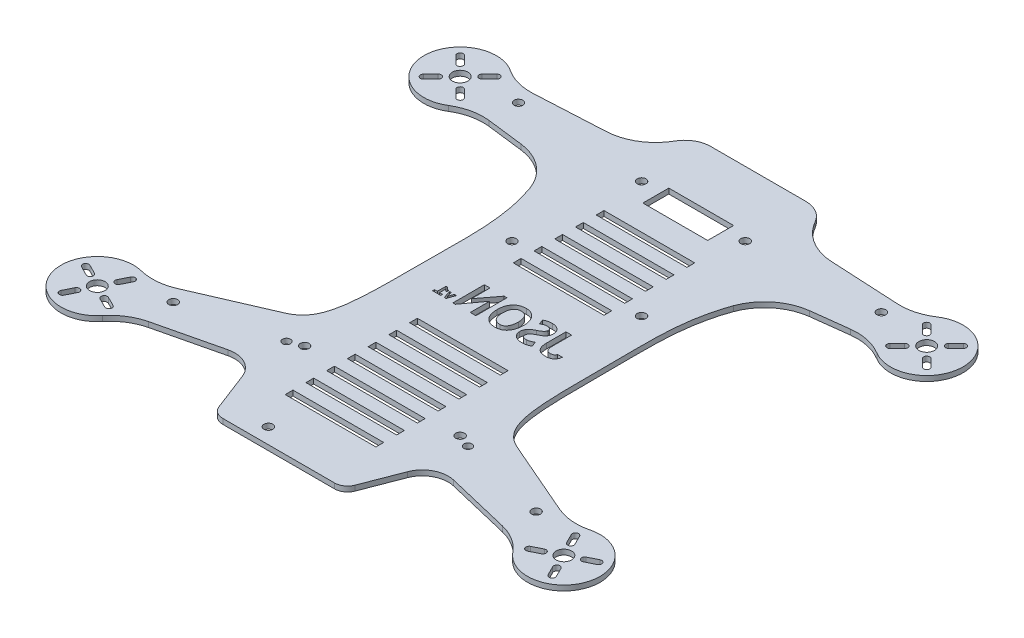
from build123d import *

# Parameters (mm, degrees)
BOSS_EXTRUDE1_DEPTH  = 2
FILLET1_DEPTH        = 2
FILLET2_R            = 10
FILLET3_R            = 20
FILLET4_R            = 10
CUT_EXTRUDE1_DEPTH   = 141.872282725
CUT_EXTRUDE3_DEPTH   = 141.872282725
SKETCH3_R            = 3
CUT_EXTRUDE2_DEPTH   = 141.872282725
CIRPATTERN1_COUNT    = 4
CIRPATTERN2_COUNT    = 4
MIRROR1_COPY_1_DEPTH = 141.872282725
MIRROR1_COPY_2_DEPTH = 141.872282725
MIRROR1_COPY_3_DEPTH = 141.872282725
MIRROR1_COPY_4_DEPTH = 141.872282725
MIRROR1_COPY_5_DEPTH = 141.872282725
MIRROR1_COPY_6_DEPTH = 141.872282725
SKETCH5_R            = 1.7
CUT_EXTRUDE4_DEPTH   = 141.872282725
SKETCH6_W            = 25
SKETCH6_H            = 10
CUT_EXTRUDE5_DEPTH   = 141.872282725
FILLET5_R            = 5
SKETCH7_W            = 35
SKETCH7_H            = 3
CUT_EXTRUDE6_DEPTH   = 141.872282725
SKETCH8_R            = 1.55
CUT_EXTRUDE7_DEPTH   = 141.872282725


with BuildPart() as part:
    # Sketch1 → Boss-Extrude1 (new body)
    with BuildSketch(Plane(origin=(0, 0, 0), x_dir=(1, 0, 0), z_dir=(0, 1, 0))):
        with BuildLine():
            Line((-78.510874707, 78), (-25, 80.804386111))
            Line((-25, 80.804386111), (-25, 95))
            Line((-25, 95), (25, 95))
            Line((25, 95), (25, 80.804386111))
            Line((25, 80.804386111), (78.510874707, 78))
            ThreePointArc((78.510874707, 78), (104, 70), (78.510874707, 62))
            Line((78.510874707, 62), (45, 57.885381964))
            add(Edge.make_bspline(
                [(45, 57.885381964), (33.861672059, 40.176941325), (35.131875882, 16.931364499), (34.80960819, -29.268629503), (36.343615545, -39.147258), (45, -42.89948064)],
                knots=[0, 0, 0, 0, 0.35075802, 0.45075802, 1, 1, 1, 1], degree=3))
            Line((45, -42.89948064), (81.630280853, -58.777353191))
            ThreePointArc((81.630280853, -58.777353191), (103.281566173, -74.427188724), (76.570636597, -73.956285959))
            Line((76.570636597, -73.956285959), (35, -64.025963414))
            Line((35, -64.025963414), (25, -90))
            Line((25, -90), (-25, -90))
            Line((-25, -90), (-35, -64.025963414))
            Line((-35, -64.025963414), (-76.570636597, -73.956285959))
            ThreePointArc((-76.570636597, -73.956285959), (-103.281566173, -74.427188724), (-81.630280853, -58.777353191))
            Line((-81.630280853, -58.777353191), (-45, -42.89948064))
            add(Edge.make_bspline(
                [(-45, 57.885381964), (-33.861672059, 40.176941325), (-35.131875882, 16.931364499), (-34.80960819, -29.268629503), (-36.343615545, -39.147258), (-45, -42.89948064)],
                knots=[0, 0, 0, 0, 0.35075802, 0.45075802, 1, 1, 1, 1], degree=3))
            Line((-45, 57.885381964), (-78.510874707, 62))
            ThreePointArc((-78.510874707, 62), (-104, 70), (-78.510874707, 78))
        make_face()
    extrude(amount=BOSS_EXTRUDE1_DEPTH)

    # Fillet1: read off the stored shape, not the designer's step
    # Fillet1 outline → Fillet1 (add)
    with BuildSketch(Plane(origin=(0, 0, 0), x_dir=(1, 0, 0), z_dir=(0, 1, 0))):
        with BuildLine():
            ThreePointArc((43.365148071, 79.841909484), (31.680788468, 84.389856442), (25, 95))
            Line((25, 95), (25, 80.804386111))
            Line((25, 80.804386111), (43.365148071, 79.841909484))
        make_face()
        with BuildLine():
            Line((-25, 80.804386111), (-25, 95))
            ThreePointArc((-25, 95), (-31.680788468, 84.389856442), (-43.365148071, 79.841909484))
            Line((-43.365148071, 79.841909484), (-25, 80.804386111))
        make_face()
    extrude(amount=FILLET1_DEPTH)

    # Fillet2
    fillet2_edges = [part.edges().sort_by_distance(p)[0] for p in [
        (-25, 1, -95),
        (25, 1, -95),
    ]]
    fillet(fillet2_edges, radius=FILLET2_R)

    # Fillet3
    fillet3_edges = [part.edges().sort_by_distance(p)[0] for p in [
        (76.570636597, 1, 73.956285959),
        (81.630280853, 1, 58.777353191),
        (-81.630280853, 1, 58.777353191),
        (-76.570636597, 1, 73.956285959),
        (78.510874707, 1, -78),
        (78.510874707, 1, -62),
        (45, 1, -57.885381964),
        (-45, 1, -57.885381964),
        (-78.510874707, 1, -78),
        (-78.510874707, 1, -62),
    ]]
    fillet(fillet3_edges, radius=FILLET3_R)

    # Fillet4
    fillet4_edges = [part.edges().sort_by_distance(p)[0] for p in [
        (35, 1, 64.025963414),
        (-35, 1, 64.025963414),
    ]]
    fillet(fillet4_edges, radius=FILLET4_R)

    # Sketch2 → Cut-Extrude1 (cut, through all)
    with BuildSketch(Plane(origin=(0, 2, 0), x_dir=(1, 0, 0), z_dir=(0, 1, 0))):
        with BuildLine():
            Line((-97.919595949, 63.777460326), (-95.091168825, 66.60588745))
            ThreePointArc((-95.091168825, 66.60588745), (-93.39411255, 66.60588745), (-93.39411255, 64.908831175))
            Line((-93.39411255, 64.908831175), (-96.222539674, 62.080404051))
            ThreePointArc((-96.222539674, 62.080404051), (-97.919595949, 62.080404051), (-97.919595949, 63.777460326))
        make_face()
    cut_extrude1 = extrude(amount=-CUT_EXTRUDE1_DEPTH, mode=Mode.SUBTRACT)

    # Sketch4 → Cut-Extrude3 (cut, through all)
    with BuildSketch(Plane(origin=(0, 2, 0), x_dir=(1, 0, 0), z_dir=(0, 1, 0))):
        with BuildLine():
            Line((-91.609968944, -75.903219461), (-93.398823326, -79.480928225))
            ThreePointArc((-93.398823326, -79.480928225), (-95.00879227, -80.017584539), (-95.545448584, -78.407615595))
            Line((-95.545448584, -78.407615595), (-93.756594202, -74.829906831))
            ThreePointArc((-93.756594202, -74.829906831), (-92.146625258, -74.293250517), (-91.609968944, -75.903219461))
        make_face()
    cut_extrude3 = extrude(amount=-CUT_EXTRUDE3_DEPTH, mode=Mode.SUBTRACT)

    # Sketch3 → Cut-Extrude2 (cut, through all)
    with BuildSketch(Plane(origin=(0, 2, 0), x_dir=(1, 0, 0), z_dir=(0, 1, 0))):
        with Locations(Location((-90, 70, 0), (0, 0, 270))):
            Circle(SKETCH3_R)
        with Locations(Location((-90, -70, 0), (0, 0, 270))):
            Circle(SKETCH3_R)
    cut_extrude2 = extrude(amount=-CUT_EXTRUDE2_DEPTH, mode=Mode.SUBTRACT)

    # CirPattern1: Cut-Extrude1 ×4 about axis
    cirpattern1_axis = Axis((-90, 0, -70), (0, 1, 0))
    for i in range(1, CIRPATTERN1_COUNT):
        add(cut_extrude1.rotate(cirpattern1_axis, i * 360 / CIRPATTERN1_COUNT), mode=Mode.SUBTRACT)

    # CirPattern2: Cut-Extrude3 ×4 about axis
    cirpattern2_axis = Axis((-90, 0, 70), (0, 1, 0))
    for i in range(1, CIRPATTERN2_COUNT):
        add(cut_extrude3.rotate(cirpattern2_axis, i * 360 / CIRPATTERN2_COUNT), mode=Mode.SUBTRACT)

    # Mirror1: Cut-Extrude1, Cut-Extrude3, Cut-Extrude2 across plane
    add(cut_extrude1.mirror(Plane(origin=(0, 0, 0), x_dir=(0, 0, 1), z_dir=(1, 0, 0))), mode=Mode.SUBTRACT)
    add(cut_extrude3.mirror(Plane(origin=(0, 0, 0), x_dir=(0, 0, 1), z_dir=(1, 0, 0))), mode=Mode.SUBTRACT)
    add(cut_extrude2.mirror(Plane(origin=(0, 0, 0), x_dir=(0, 0, 1), z_dir=(1, 0, 0))), mode=Mode.SUBTRACT)

    # Mirror1 copy 1 sketch → Mirror1 copy 1 (cut, through all)
    with BuildSketch(Plane(origin=(20, 2, -160), x_dir=(0, 0, -1), z_dir=(0, 1, 0))):
        with BuildLine():
            Line((-97.919595949, -63.777460326), (-95.091168825, -66.60588745))
            ThreePointArc((-95.091168825, -66.60588745), (-93.39411255, -66.60588745), (-93.39411255, -64.908831175))
            Line((-93.39411255, -64.908831175), (-96.222539674, -62.080404051))
            ThreePointArc((-96.222539674, -62.080404051), (-97.919595949, -62.080404051), (-97.919595949, -63.777460326))
        make_face()
    extrude(amount=-MIRROR1_COPY_1_DEPTH, mode=Mode.SUBTRACT)

    # Mirror1 copy 2 sketch → Mirror1 copy 2 (cut, through all)
    with BuildSketch(Plane(origin=(180, 2, -140), x_dir=(1, 0, 0), z_dir=(0, 1, 0))):
        with BuildLine():
            Line((-97.919595949, -63.777460326), (-95.091168825, -66.60588745))
            ThreePointArc((-95.091168825, -66.60588745), (-93.39411255, -66.60588745), (-93.39411255, -64.908831175))
            Line((-93.39411255, -64.908831175), (-96.222539674, -62.080404051))
            ThreePointArc((-96.222539674, -62.080404051), (-97.919595949, -62.080404051), (-97.919595949, -63.777460326))
        make_face()
    extrude(amount=-MIRROR1_COPY_2_DEPTH, mode=Mode.SUBTRACT)

    # Mirror1 copy 3 sketch → Mirror1 copy 3 (cut, through all)
    with BuildSketch(Plane(origin=(160, 2, 20), x_dir=(0, 0, 1), z_dir=(0, 1, 0))):
        with BuildLine():
            Line((-97.919595949, -63.777460326), (-95.091168825, -66.60588745))
            ThreePointArc((-95.091168825, -66.60588745), (-93.39411255, -66.60588745), (-93.39411255, -64.908831175))
            Line((-93.39411255, -64.908831175), (-96.222539674, -62.080404051))
            ThreePointArc((-96.222539674, -62.080404051), (-97.919595949, -62.080404051), (-97.919595949, -63.777460326))
        make_face()
    extrude(amount=-MIRROR1_COPY_3_DEPTH, mode=Mode.SUBTRACT)

    # Mirror1 copy 4 sketch → Mirror1 copy 4 (cut, through all)
    with BuildSketch(Plane(origin=(160, 2, -20), x_dir=(0, 0, -1), z_dir=(0, 1, 0))):
        with BuildLine():
            Line((-91.609968944, 75.903219461), (-93.398823326, 79.480928225))
            ThreePointArc((-93.398823326, 79.480928225), (-95.00879227, 80.017584539), (-95.545448584, 78.407615595))
            Line((-95.545448584, 78.407615595), (-93.756594202, 74.829906831))
            ThreePointArc((-93.756594202, 74.829906831), (-92.146625258, 74.293250517), (-91.609968944, 75.903219461))
        make_face()
    extrude(amount=-MIRROR1_COPY_4_DEPTH, mode=Mode.SUBTRACT)

    # Mirror1 copy 5 sketch → Mirror1 copy 5 (cut, through all)
    with BuildSketch(Plane(origin=(180, 2, 140), x_dir=(1, 0, 0), z_dir=(0, 1, 0))):
        with BuildLine():
            Line((-91.609968944, 75.903219461), (-93.398823326, 79.480928225))
            ThreePointArc((-93.398823326, 79.480928225), (-95.00879227, 80.017584539), (-95.545448584, 78.407615595))
            Line((-95.545448584, 78.407615595), (-93.756594202, 74.829906831))
            ThreePointArc((-93.756594202, 74.829906831), (-92.146625258, 74.293250517), (-91.609968944, 75.903219461))
        make_face()
    extrude(amount=-MIRROR1_COPY_5_DEPTH, mode=Mode.SUBTRACT)

    # Mirror1 copy 6 sketch → Mirror1 copy 6 (cut, through all)
    with BuildSketch(Plane(origin=(20, 2, 160), x_dir=(0, 0, 1), z_dir=(0, 1, 0))):
        with BuildLine():
            Line((-91.609968944, 75.903219461), (-93.398823326, 79.480928225))
            ThreePointArc((-93.398823326, 79.480928225), (-95.00879227, 80.017584539), (-95.545448584, 78.407615595))
            Line((-95.545448584, 78.407615595), (-93.756594202, 74.829906831))
            ThreePointArc((-93.756594202, 74.829906831), (-92.146625258, 74.293250517), (-91.609968944, 75.903219461))
        make_face()
    extrude(amount=-MIRROR1_COPY_6_DEPTH, mode=Mode.SUBTRACT)

    # Sketch5 → Cut-Extrude4 (cut, through all)
    with BuildSketch(Plane(origin=(0, 2, 0), x_dir=(1, 0, 0), z_dir=(0, 1, 0))):
        with Locations(Location((-70, 72.5, 0), (0, 0, 270))):
            Circle(SKETCH5_R)
        with Locations(Location((-70, -60.69810195, 0), (0, 0, 270))):
            Circle(SKETCH5_R)
        with Locations(Location((70, -60.69810195, 0), (0, 0, 90))):
            Circle(SKETCH5_R)
        with Locations(Location((70, 72.5, 0), (0, 0, 90))):
            Circle(SKETCH5_R)
        with Locations(Location((-20, 70, 0), (0, 0, 270))):
            Circle(SKETCH5_R)
        with Locations(Location((-30, -50, 0), (0, 0, 270))):
            Circle(SKETCH5_R)
        with Locations(Location((30, -50, 0), (0, 0, 90))):
            Circle(SKETCH5_R)
        with Locations(Location((20, 70, 0), (0, 0, 90))):
            Circle(SKETCH5_R)
        with Locations(Location((-25, 25, 0), (0, 0, 270))):
            Circle(SKETCH5_R)
        with Locations(Location((25, 25, 0), (0, 0, 270))):
            Circle(SKETCH5_R)
        with Locations(Location((-10, -84, 0), (0, 0, 270))):
            Circle(SKETCH5_R)
    extrude(amount=-CUT_EXTRUDE4_DEPTH, mode=Mode.SUBTRACT)

    # Sketch6 → Cut-Extrude5 (cut, through all)
    with BuildSketch(Plane(origin=(0, 2, 0), x_dir=(1, 0, 0), z_dir=(0, 1, 0))):
        with Locations((0, 68)):
            Rectangle(SKETCH6_W, SKETCH6_H)
    extrude(amount=-CUT_EXTRUDE5_DEPTH, mode=Mode.SUBTRACT)

    # Fillet5
    fillet5_edges = [part.edges().sort_by_distance(p)[0] for p in [
        (25, 1, 90),
        (-25, 1, 90),
    ]]
    fillet(fillet5_edges, radius=FILLET5_R)

    # Sketch7 → Cut-Extrude6 (cut, through all)
    # profile 1 of 18: a face of its own
    with BuildSketch(Plane(origin=(0, 0, 0), x_dir=(1, 0, 0), z_dir=(0, 1, 0))):
        with Locations((0, 43.5)):
            Rectangle(SKETCH7_W, SKETCH7_H)
    # profile 2 of 18: a face of its own
    with BuildSketch(Plane(origin=(0, 0, 0), x_dir=(1, 0, 0), z_dir=(0, 1, 0))):
        with Locations((0, 51.5)):
            Rectangle(SKETCH7_W, SKETCH7_H)
    # profile 3 of 18: a face of its own
    with BuildSketch(Plane(origin=(0, 0, 0), x_dir=(1, 0, 0), z_dir=(0, 1, 0))):
        with Locations((0, 35.5)):
            Rectangle(SKETCH7_W, SKETCH7_H)
    # profile 4 of 18: a face of its own
    with BuildSketch(Plane(origin=(0, 0, 0), x_dir=(1, 0, 0), z_dir=(0, 1, 0))):
        with Locations((0, 27.5)):
            Rectangle(SKETCH7_W, SKETCH7_H)
    # profile 5 of 18: a face of its own
    with BuildSketch(Plane(origin=(0, 0, 0), x_dir=(1, 0, 0), z_dir=(0, 1, 0))):
        with Locations((0, 19.5)):
            Rectangle(SKETCH7_W, SKETCH7_H)
    # profile 6 of 18: a face of its own
    with BuildSketch(Plane(origin=(0, 0, 0), x_dir=(1, 0, 0), z_dir=(0, 1, 0))):
        with Locations((0, -20.5)):
            Rectangle(SKETCH7_W, SKETCH7_H)
    # profile 7 of 18: a face of its own
    with BuildSketch(Plane(origin=(0, 0, 0), x_dir=(1, 0, 0), z_dir=(0, 1, 0))):
        with Locations((0, -28.5)):
            Rectangle(SKETCH7_W, SKETCH7_H)
    # profile 8 of 18: a face of its own
    with BuildSketch(Plane(origin=(0, 0, 0), x_dir=(1, 0, 0), z_dir=(0, 1, 0))):
        with Locations((0, -36.5)):
            Rectangle(SKETCH7_W, SKETCH7_H)
    # profile 9 of 18: a face of its own
    with BuildSketch(Plane(origin=(0, 0, 0), x_dir=(1, 0, 0), z_dir=(0, 1, 0))):
        with Locations((0, -44.5)):
            Rectangle(SKETCH7_W, SKETCH7_H)
    # profile 10 of 18: a face of its own
    with BuildSketch(Plane(origin=(0, 0, 0), x_dir=(1, 0, 0), z_dir=(0, 1, 0))):
        with Locations((0, -52.5)):
            Rectangle(SKETCH7_W, SKETCH7_H)
    # profile 11 of 18: a face of its own
    with BuildSketch(Plane(origin=(0, 0, 0), x_dir=(1, 0, 0), z_dir=(0, 1, 0))):
        with Locations((0, -60.5)):
            Rectangle(SKETCH7_W, SKETCH7_H)
    # profile 12 of 18: a face of its own
    with BuildSketch(Plane(origin=(0, 0, 0), x_dir=(1, 0, 0), z_dir=(0, 1, 0))):
        with Locations((0, -68.5)):
            Rectangle(SKETCH7_W, SKETCH7_H)
    # profile 13 of 18: a face of its own
    with BuildSketch(Plane(origin=(0, 0, 0), x_dir=(1, 0, 0), z_dir=(0, 1, 0))):
        with BuildLine():
            Line((23.486534827, -4.059636512), (21.616404957, -4.059636512))
            add(Edge.make_bspline(
                [(21.616404957, -4.059636512), (21.590539652, -4.146201564), (21.540251592, -4.314503796), (21.409861626, -4.540528012), (21.241242468, -4.732205785), (21.031820734, -4.887683612), (20.783767696, -5.007326047), (20.498320323, -5.090803795), (20.175072911, -5.142313543), (19.946973623, -5.147702486), (19.82663223, -5.150545603)],
                knots=[0, 0, 0, 0, 0.947806518, 1.842752335, 2.719924176, 3.616497909, 4.567376492, 5.601981394, 6.734845249, 8, 8, 8, 8], degree=3))
            add(Edge.make_bspline(
                [(19.82663223, -5.150545603), (19.740494467, -5.148979354), (19.574079418, -5.145953418), (19.334818563, -5.114338338), (19.115029591, -5.060692648), (18.915227709, -4.985875341), (18.734224584, -4.889418642), (18.571976835, -4.773012562), (18.432548987, -4.631753145), (18.310470773, -4.470848501), (18.210582304, -4.286036582), (18.118311804, -4.082606607), (18.045423167, -3.855671891), (17.980719086, -3.608076013), (17.933319552, -3.337649353), (17.899678691, -3.045751677), (17.880606695, -2.731967409), (17.87766836, -2.515830894), (17.876145217, -2.403792356)],
                knots=[0, 0, 0, 0, 1.067626768, 2.062616369, 2.985343842, 3.867664664, 4.700674017, 5.522049446, 6.333373676, 7.152649818, 8.017811797, 8.932434615, 9.919091807, 10.968777207, 12.103958482, 13.319924728, 14.610731221, 16, 16, 16, 16], degree=3))
            Line((17.876145217, -2.403792356), (17.876145217, 5.135168683))
            Line((17.876145217, 5.135168683), (15.694327035, 5.135168683))
            Line((15.694327035, 5.135168683), (15.694327035, -2.321000148))
            add(Edge.make_bspline(
                [(15.694327035, -2.321000148), (15.697798922, -2.514274391), (15.704505199, -2.887601748), (15.75021039, -3.428772754), (15.828771752, -3.931511996), (15.944107658, -4.395202808), (16.085467588, -4.822415028), (16.26490107, -5.2095269), (16.47304874, -5.560113928), (16.717395873, -5.870585449), (16.995068691, -6.146052642), (17.31554801, -6.378818532), (17.670999874, -6.5820315), (18.068914366, -6.739647644), (18.503017325, -6.86804934), (18.97649817, -6.954597166), (19.488304842, -7.013379009), (19.842683601, -7.018185141), (20.026307555, -7.020675473)],
                knots=[0, 0, 0, 0, 1.257716504, 2.429397589, 3.531412397, 4.565288384, 5.535798267, 6.455165842, 7.336603603, 8.183031914, 9.019729221, 9.873362564, 10.753279565, 11.677293996, 12.651763286, 13.694988756, 14.80564151, 16, 16, 16, 16], degree=3))
            add(Edge.make_bspline(
                [(20.026307555, -7.020675473), (20.148976485, -7.018477615), (20.389196236, -7.014173601), (20.740727978, -6.976363086), (21.074610361, -6.918034694), (21.388805621, -6.82757103), (21.686417663, -6.719813612), (21.966659291, -6.585055424), (22.226809449, -6.423746851), (22.468721437, -6.241020273), (22.689368378, -6.037004606), (22.881013061, -5.808593582), (23.051301089, -5.56442766), (23.192139019, -5.299995832), (23.308180154, -5.017170975), (23.394524699, -4.714844872), (23.456193973, -4.393638276), (23.476263427, -4.172707347), (23.486534827, -4.059636512)],
                knots=[0, 0, 0, 0, 1.156414506, 2.264580001, 3.330518922, 4.348265744, 5.343573954, 6.31239471, 7.274662335, 8.225322482, 9.167626239, 10.101624297, 11.031567692, 11.969883899, 12.920790522, 13.909098896, 14.929892097, 16, 16, 16, 16], degree=3))
        make_face()
    # profile 14 of 18: a face of its own
    with BuildSketch(Plane(origin=(0, 0, 0), x_dir=(1, 0, 0), z_dir=(0, 1, 0))):
        with BuildLine():
            Line((13.980041321, -6.144052096), (13.193515347, -4.215480668))
            add(Edge.make_bspline(
                [(13.193515347, -4.215480668), (13.089803754, -4.290020873), (12.886695767, -4.435999837), (12.571810728, -4.625096888), (12.259306298, -4.787709127), (11.947336703, -4.919329576), (11.637227107, -5.022618622), (11.328525297, -5.096159042), (11.020384969, -5.142018271), (10.814610183, -5.147711669), (10.712184178, -5.150545603)],
                knots=[0, 0, 0, 0, 1.136007301, 2.224747964, 3.264852221, 4.268199212, 5.234281408, 6.169723066, 7.088965376, 8, 8, 8, 8], degree=3))
            add(Edge.make_bspline(
                [(10.712184178, -5.150545603), (10.636682868, -5.149593534), (10.490399899, -5.147748912), (10.277200011, -5.134027059), (10.079202365, -5.106164091), (9.894703175, -5.073876847), (9.726268434, -5.027259799), (9.572922334, -4.970737609), (9.43078381, -4.908466163), (9.306065381, -4.830440894), (9.194448811, -4.744620087), (9.097609189, -4.648839385), (9.018174856, -4.541192975), (8.950371133, -4.425022867), (8.899828733, -4.297630524), (8.863395767, -4.160325704), (8.841078578, -4.013285323), (8.838505681, -3.91198929), (8.837184178, -3.859961187)],
                knots=[0, 0, 0, 0, 1.401766768, 2.715907925, 3.962657228, 5.112374902, 6.190855148, 7.201508297, 8.145595777, 9.065685882, 9.924766831, 10.755902676, 11.584712895, 12.401517737, 13.24660729, 14.12023553, 15.034507313, 16, 16, 16, 16], degree=3))
            add(Edge.make_bspline(
                [(8.837184178, -3.859961187), (8.841839258, -3.759459342), (8.85117013, -3.558008507), (8.944000163, -3.262854471), (9.084244745, -2.97519077), (9.246382687, -2.743369206), (9.412874428, -2.562332069), (9.567734537, -2.417538947), (9.752985319, -2.270111744), (9.968590609, -2.11957091), (10.212619268, -1.964158558), (10.485500799, -1.80263535), (10.790025641, -1.641551225), (11.113245125, -1.477857015), (11.438454651, -1.318864144), (11.741077522, -1.156343547), (12.019816146, -1.008549955), (12.265346811, -0.860301119), (12.485441182, -0.724560331), (12.678807678, -0.596854503), (12.841250513, -0.472770588), (13.021086265, -0.320433365), (13.211458106, -0.122014909), (13.410368833, 0.134044893), (13.584575483, 0.409549345), (13.727768418, 0.707046474), (13.840864044, 1.023682366), (13.919652825, 1.356944701), (13.970468051, 1.706673713), (13.976801604, 1.945052281), (13.980041321, 2.066986865)],
                knots=[0, 0, 0, 0, 1.007268037, 2.019017529, 3.080569339, 4.216537656, 4.845867131, 5.549892432, 6.344775691, 7.222815839, 8.191223188, 9.251583546, 10.408386407, 11.652290731, 12.89252591, 14.045497858, 15.103974246, 16.062194638, 16.926796162, 17.702747382, 18.389552066, 18.979653935, 20.069867651, 21.14508814, 22.233622371, 23.338987086, 24.456086491, 25.6055042, 26.775175755, 28, 28, 28, 28], degree=3))
            add(Edge.make_bspline(
                [(13.980041321, 2.066986865), (13.97648923, 2.180772558), (13.969532646, 2.403615876), (13.922920917, 2.731213929), (13.842786799, 3.043166934), (13.729124674, 3.340805915), (13.585890628, 3.624036482), (13.408489358, 3.891285389), (13.200011744, 4.143043727), (12.962338586, 4.378602186), (12.697830379, 4.590890165), (12.414921642, 4.779694666), (12.11318547, 4.939128448), (11.792453157, 5.068455452), (11.453804171, 5.167823854), (11.097571811, 5.237752145), (10.72391202, 5.28327663), (10.468003387, 5.288395896), (10.337184178, 5.291012839)],
                knots=[0, 0, 0, 0, 1.003005018, 1.964332776, 2.910170471, 3.836426429, 4.767643916, 5.702373581, 6.657932039, 7.644570869, 8.646963147, 9.643207292, 10.638654535, 11.649819263, 12.686782134, 13.74485981, 14.847183648, 16, 16, 16, 16], degree=3))
            add(Edge.make_bspline(
                [(10.337184178, 5.291012839), (10.169109879, 5.28875466), (9.844711144, 5.284396169), (9.375182082, 5.248900407), (8.940545463, 5.184174383), (8.538689395, 5.103003615), (8.173047789, 4.988548109), (7.839774424, 4.856404355), (7.539698227, 4.697503934), (7.364109458, 4.565990379), (7.27874262, 4.5020518)],
                knots=[0, 0, 0, 0, 1.25415376, 2.420631203, 3.510208484, 4.531841497, 5.476356325, 6.36491274, 7.205061743, 8, 8, 8, 8], degree=3))
            Line((7.27874262, 4.5020518), (7.919164698, 2.641662189))
            add(Edge.make_bspline(
                [(7.919164698, 2.641662189), (8.011616291, 2.70397099), (8.194194905, 2.827021918), (8.479896876, 2.984353751), (8.767661777, 3.119195983), (9.058919049, 3.229675381), (9.354509614, 3.315339333), (9.654229451, 3.375810522), (9.957950156, 3.413997941), (10.161748063, 3.418580685), (10.26413223, 3.420882969)],
                knots=[0, 0, 0, 0, 1.065306581, 2.103827425, 3.113989297, 4.101151914, 5.078507631, 6.052407603, 7.021566866, 8, 8, 8, 8], degree=3))
            add(Edge.make_bspline(
                [(10.26413223, 3.420882969), (10.379769625, 3.416535182), (10.598854752, 3.408297921), (10.908756797, 3.337928314), (11.1768197, 3.215118742), (11.401036573, 3.045247446), (11.578964532, 2.837954606), (11.708320672, 2.599269527), (11.786219383, 2.329881086), (11.794130635, 2.140568142), (11.798223139, 2.042636215)],
                knots=[0, 0, 0, 0, 1.191848157, 2.258060239, 3.254500576, 4.210660285, 5.136954709, 6.051060518, 6.991810101, 8, 8, 8, 8], degree=3))
            add(Edge.make_bspline(
                [(11.798223139, 2.042636215), (11.79051317, 1.956391607), (11.774460585, 1.776825531), (11.656669554, 1.512499864), (11.471199082, 1.250771827), (11.215244763, 0.986810542), (10.887857964, 0.723184021), (10.490485381, 0.455772083), (10.021878114, 0.186382144), (9.679947801, 0.017901717), (9.49952184, -0.071000148)],
                knots=[0, 0, 0, 0, 0.634420533, 1.320898859, 2.099052417, 2.991721158, 4.020274054, 5.191524251, 6.518054955, 8, 8, 8, 8], degree=3))
            add(Edge.make_bspline(
                [(9.49952184, -0.071000148), (9.401960429, -0.118558509), (9.212377378, -0.210974752), (8.940152063, -0.350387956), (8.691384163, -0.492144505), (8.459156256, -0.622346067), (8.252890808, -0.758711317), (8.064423278, -0.886221746), (7.898274979, -1.012710431), (7.708054417, -1.177558916), (7.49664141, -1.390933831), (7.2739818, -1.665756466), (7.085806834, -1.962971193), (6.928682429, -2.27831284), (6.806534966, -2.614135446), (6.719848717, -2.968476718), (6.663763061, -3.341945142), (6.658209532, -3.597577824), (6.655365996, -3.728467681)],
                knots=[0, 0, 0, 0, 1.052064308, 2.044389866, 2.963696578, 3.827350817, 4.623892154, 5.35934089, 6.032843241, 6.646420978, 7.79803462, 8.939525473, 10.067926653, 11.200899104, 12.348312514, 13.52375994, 14.732107711, 16, 16, 16, 16], degree=3))
            add(Edge.make_bspline(
                [(6.655365996, -3.728467681), (6.658083145, -3.845604228), (6.663437032, -4.076410839), (6.722434324, -4.413451127), (6.811836736, -4.735751628), (6.939212787, -5.041735314), (7.103615947, -5.33116254), (7.305741088, -5.603282415), (7.54389553, -5.859700924), (7.814888321, -6.099589238), (8.117493347, -6.315248509), (8.444481774, -6.507789199), (8.799794844, -6.663391607), (9.17644595, -6.797876821), (9.579376751, -6.894662953), (10.00539882, -6.968702207), (10.456392255, -7.012690438), (10.765659405, -7.0179712), (10.924034827, -7.020675473)],
                knots=[0, 0, 0, 0, 0.930489607, 1.833442742, 2.712008397, 3.585796038, 4.461583632, 5.352274502, 6.274873984, 7.239650429, 8.224764477, 9.225464117, 10.251038592, 11.304305412, 12.401618379, 13.541203338, 14.740852494, 16, 16, 16, 16], degree=3))
            add(Edge.make_bspline(
                [(10.924034827, -7.020675473), (11.06374945, -7.017771087), (11.339735378, -7.012033895), (11.748169166, -6.969300059), (12.146011469, -6.901287511), (12.534684914, -6.806841889), (12.912707106, -6.681612162), (13.28066852, -6.530720095), (13.638393464, -6.352999743), (13.865754184, -6.21394871), (13.980041321, -6.144052096)],
                knots=[0, 0, 0, 0, 1.040147641, 2.054660472, 3.05421144, 4.043643693, 5.029821955, 6.016352017, 7.002882079, 8, 8, 8, 8], degree=3))
        make_face()
    # profile 15 of 18: a face of its own
    with BuildSketch(Plane(origin=(0, 0, 0), x_dir=(1, 0, 0), z_dir=(0, 1, 0))):
        with BuildLine():
            add(Edge.make_bspline(
                [(5.408612749, -0.76742872), (5.404562971, -0.559455624), (5.396600655, -0.150557382), (5.329078483, 0.450301406), (5.220527913, 1.02706687), (5.066553701, 1.578291221), (4.871641595, 2.10635207), (4.62976517, 2.607753836), (4.345363504, 3.086567133), (4.019870227, 3.536055934), (3.656676909, 3.946992929), (3.261088495, 4.308140305), (2.833712128, 4.6118662), (2.378989103, 4.863573433), (1.891430422, 5.052483799), (1.376930882, 5.192730755), (0.831827998, 5.276756782), (0.458419675, 5.286201384), (0.268190672, 5.291012839)],
                knots=[0, 0, 0, 0, 1.12167397, 2.205335798, 3.257359149, 4.28470671, 5.289217279, 6.290017909, 7.2835501, 8.289929564, 9.279400664, 10.237284933, 11.172880942, 12.101771852, 13.033630473, 13.986457049, 14.974221394, 16, 16, 16, 16], degree=3))
            add(Edge.make_bspline(
                [(0.268190672, 5.291012839), (0.059337251, 5.28685163), (-0.346831341, 5.278759103), (-0.93620781, 5.201350253), (-1.487811777, 5.078191457), (-2.002864252, 4.905346313), (-2.480591818, 4.681813722), (-2.91757726, 4.403201752), (-3.31728597, 4.077182096), (-3.678376586, 3.703503275), (-3.998092579, 3.284388955), (-4.277336862, 2.824374358), (-4.510080195, 2.322023547), (-4.703271331, 1.781861968), (-4.850589517, 1.201081701), (-4.95727841, 0.580803869), (-5.020478132, -0.080241092), (-5.028716706, -0.534335262), (-5.032945692, -0.76742872)],
                knots=[0, 0, 0, 0, 1.094302161, 2.128148861, 3.109755598, 4.052942173, 4.970325235, 5.867394864, 6.762494762, 7.6682003, 8.584724561, 9.520192566, 10.483321464, 11.481895952, 12.523140575, 13.619946136, 14.778282076, 16, 16, 16, 16], degree=3))
            add(Edge.make_bspline(
                [(-5.032945692, -0.76742872), (-5.029288969, -1.001390514), (-5.022162118, -1.457375522), (-4.95083174, -2.121947955), (-4.844104266, -2.750324838), (-4.688579219, -3.342377696), (-4.485071418, -3.896504266), (-4.243121338, -4.416495542), (-3.950478741, -4.89591045), (-3.618375496, -5.337832406), (-3.242453234, -5.733186816), (-2.829149875, -6.079480142), (-2.376493616, -6.371426626), (-1.887000027, -6.610968719), (-1.35974582, -6.796341052), (-0.795549071, -6.927178305), (-0.194248767, -7.005629436), (0.21924918, -7.015574476), (0.431340022, -7.020675473)],
                knots=[0, 0, 0, 0, 1.193047852, 2.325216966, 3.40551617, 4.441966791, 5.442719475, 6.41325974, 7.362664319, 8.302568306, 9.228043188, 10.139349658, 11.046649703, 11.968821361, 12.913011083, 13.89122261, 14.918368581, 16, 16, 16, 16], degree=3))
            add(Edge.make_bspline(
                [(0.431340022, -7.020675473), (0.626401805, -7.015559599), (1.00678437, -7.005583329), (1.559712145, -6.927252562), (2.077355216, -6.795531928), (2.560093976, -6.612996794), (3.00806181, -6.377474228), (3.420264024, -6.087540408), (3.797016437, -5.744471921), (4.135770592, -5.34972344), (4.436460657, -4.911466412), (4.699346032, -4.433061546), (4.916823108, -3.914683015), (5.097285085, -3.35916946), (5.238637855, -2.76561376), (5.335912811, -2.133649792), (5.399044867, -1.463517674), (5.405364042, -1.003780872), (5.408612749, -0.76742872)],
                knots=[0, 0, 0, 0, 1.03407351, 2.016507436, 2.953946609, 3.8612284, 4.746873892, 5.630509026, 6.526304084, 7.441797841, 8.382580671, 9.339935654, 10.331229986, 11.358869901, 12.434151017, 13.562799597, 14.747027522, 16, 16, 16, 16], degree=3))
        make_face()
        with BuildLine():
            add(Edge.make_bspline(
                [(3.226794568, -0.76742872), (3.224093204, -0.93629914), (3.218828513, -1.265410905), (3.188621329, -1.744375331), (3.132466353, -2.193934277), (3.055023158, -2.613645063), (2.95674283, -3.005074507), (2.831392109, -3.365750005), (2.689073709, -3.699667586), (2.521609374, -4.002072741), (2.331065326, -4.271391923), (2.121443012, -4.507155593), (1.890712404, -4.7077515), (1.637550479, -4.867996968), (1.366282824, -4.998301753), (1.072971012, -5.086352843), (0.759770777, -5.14219771), (0.544414185, -5.147712426), (0.433775087, -5.150545603)],
                knots=[0, 0, 0, 0, 1.386949845, 2.703028227, 3.939136446, 5.105380537, 6.206418067, 7.249934597, 8.238160388, 9.184112965, 10.083023957, 10.942201547, 11.769362519, 12.584836935, 13.395912874, 14.233006541, 15.092209991, 16, 16, 16, 16], degree=3))
            add(Edge.make_bspline(
                [(0.433775087, -5.150545603), (0.303697558, -5.147741932), (0.051289049, -5.142301558), (-0.315095181, -5.08669623), (-0.658004075, -4.999379878), (-0.97915071, -4.879055733), (-1.273954335, -4.717677789), (-1.547017962, -4.524982504), (-1.793760187, -4.293653385), (-2.016442131, -4.028575201), (-2.214030575, -3.730352845), (-2.38343469, -3.399435965), (-2.53091348, -3.039061916), (-2.649717615, -2.646122646), (-2.738027174, -2.220399948), (-2.80277682, -1.764125694), (-2.846034879, -1.276373352), (-2.849396555, -0.940415958), (-2.85112751, -0.76742872)],
                knots=[0, 0, 0, 0, 1.003448592, 1.947138479, 2.85285333, 3.731395698, 4.58647826, 5.440113417, 6.304601805, 7.189466626, 8.107002249, 9.059800123, 10.054604571, 11.109044561, 12.223627675, 13.407437259, 14.665068025, 16, 16, 16, 16], degree=3))
            add(Edge.make_bspline(
                [(-2.85112751, -0.76742872), (-2.848944394, -0.598527097), (-2.844709154, -0.270858282), (-2.807735444, 0.204786602), (-2.748134939, 0.64821058), (-2.663686872, 1.058643053), (-2.554363486, 1.435939791), (-2.420703229, 1.781076446), (-2.262975933, 2.094369378), (-2.079319928, 2.375481209), (-1.869330195, 2.622005589), (-1.635667195, 2.83671506), (-1.377714618, 3.018122073), (-1.095826804, 3.16778391), (-0.788081744, 3.283083582), (-0.455754376, 3.361313409), (-0.100205878, 3.411430214), (0.144637343, 3.417671437), (0.270625736, 3.420882969)],
                knots=[0, 0, 0, 0, 1.361047238, 2.64042896, 3.842181023, 4.96476722, 6.014302711, 7.004357093, 7.943459344, 8.83611903, 9.703887246, 10.546561965, 11.386872008, 12.238437438, 13.11202975, 14.027504161, 14.98501751, 16, 16, 16, 16], degree=3))
            add(Edge.make_bspline(
                [(0.270625736, 3.420882969), (0.38609047, 3.417928662), (0.611839691, 3.412152591), (0.94077868, 3.357592712), (1.24817078, 3.266578069), (1.537791424, 3.146125836), (1.801806839, 2.981778517), (2.048159619, 2.786603114), (2.269678143, 2.5518056), (2.472788318, 2.286550834), (2.64746378, 1.988416847), (2.80574274, 1.667939338), (2.935578613, 1.32161328), (3.043488942, 0.951362853), (3.12554002, 0.556381613), (3.182428358, 0.136473432), (3.22044925, -0.307318554), (3.224644202, -0.611501896), (3.226794568, -0.76742872)],
                knots=[0, 0, 0, 0, 0.959506022, 1.875964462, 2.762230109, 3.62093182, 4.475139698, 5.339419255, 6.227250994, 7.151873485, 8.111379506, 9.095352781, 10.120651038, 11.182116411, 12.2992564, 13.471311382, 14.703773912, 16, 16, 16, 16], degree=3))
        make_face(mode=Mode.SUBTRACT)
    # profile 16 of 18: a face of its own
    with BuildSketch(Plane(origin=(0, 0, 0), x_dir=(1, 0, 0), z_dir=(0, 1, 0))):
        Polygon((-14.85112751, -7.020675473), (-9.2407379, 0.615688163), (-9.2407379, -6.864831317), (-7.058919718, -6.864831317), (-7.058919718, 5.135168683), (-8.149828809, 5.135168683), (-13.604374264, -2.033662486), (-13.604374264, 5.135168683), (-15.786192445, 5.135168683), (-15.786192445, -7.020675473), align=None)
    # profile 17 of 18: a face of its own
    with BuildSketch(Plane(origin=(0, 0, 0), x_dir=(1, 0, 0), z_dir=(0, 1, 0))):
        Polygon((-20.236111111, -3.864831317), (-19.256944444, -6.864831317), (-18.581597222, -6.864831317), (-17.541666667, -3.864831317), (-18.368923611, -3.864831317), (-18.995659722, -5.836185484), (-19.582465278, -3.864831317), align=None)
    # profile 18 of 18: a face of its own
    with BuildSketch(Plane(origin=(0, 0, 0), x_dir=(1, 0, 0), z_dir=(0, 1, 0))):
        with BuildLine():
            Line((-23.777777778, -6.864831317), (-20.611111111, -6.864831317))
            Line((-20.611111111, -6.864831317), (-20.611111111, -6.142609095))
            Line((-20.611111111, -6.142609095), (-21.777777778, -6.142609095))
            Line((-21.777777778, -6.142609095), (-21.777777778, -3.824032706))
            add(Edge.make_bspline(
                [(-21.777777778, -3.824032706), (-21.740677412, -3.86446796), (-21.667306537, -3.944434015), (-21.548943907, -4.054788211), (-21.426980929, -4.157600367), (-21.299081111, -4.250764047), (-21.165484878, -4.334016625), (-21.027664229, -4.409961547), (-20.884222242, -4.476093712), (-20.785544784, -4.513006216), (-20.736111111, -4.531497984)],
                knots=[0, 0, 0, 0, 1.034231775, 2.045329957, 3.048316587, 4.040159653, 5.025485634, 6.014203452, 7.00519106, 8, 8, 8, 8], degree=3))
            Line((-20.736111111, -4.531497984), (-20.736111111, -3.716393817))
            add(Edge.make_bspline(
                [(-20.736111111, -3.716393817), (-20.776935844, -3.700837075), (-20.854665073, -3.671217442), (-20.964728517, -3.628067653), (-21.062432274, -3.587870344), (-21.147760354, -3.551623133), (-21.220994986, -3.519879333), (-21.281349136, -3.49090241), (-21.329577216, -3.466320936), (-21.380680613, -3.436778864), (-21.440901948, -3.39196867), (-21.521260667, -3.329115993), (-21.615022457, -3.249381673), (-21.718856752, -3.157661812), (-21.823140405, -3.059118027), (-21.915704491, -2.957019019), (-21.994068031, -2.856742507), (-22.03620696, -2.787121643), (-22.056423611, -2.753720206)],
                knots=[0, 0, 0, 0, 1.255499157, 2.390437705, 3.397240845, 4.29147323, 5.054715704, 5.690713351, 6.215104523, 6.610146599, 7.385388851, 8.368494279, 9.542836286, 10.921169843, 12.350263749, 13.663053445, 14.878822134, 16, 16, 16, 16], degree=3))
            Line((-22.056423611, -2.753720206), (-22.666666667, -2.753720206))
            Line((-22.666666667, -2.753720206), (-22.666666667, -6.142609095))
            Line((-22.666666667, -6.142609095), (-23.777777778, -6.142609095))
            Line((-23.777777778, -6.142609095), (-23.777777778, -6.864831317))
        make_face()
    extrude(amount=CUT_EXTRUDE6_DEPTH, mode=Mode.SUBTRACT)


with BuildPart() as cut_extrude6_piece_1:
    # of the separate pieces the step leaves, piece 1, a body of its own (cut_extrude6_pieces)
    add(part.part.solids().sort_by_distance((-26.233363147, 0, 86.79645805))[0])

    # Sketch8 → Cut-Extrude7 (cut, through all)
    with BuildSketch(Plane(origin=(0, 2, 0), x_dir=(1, 0, 0), z_dir=(0, 1, 0))):
        with Locations(Location((-35, -52, 0), (0, 0, 270))):
            Circle(SKETCH8_R)
        with Locations(Location((35, -52, 0), (0, 0, 90))):
            Circle(SKETCH8_R)
    extrude(amount=-CUT_EXTRUDE7_DEPTH, mode=Mode.SUBTRACT)


with BuildPart() as cut_extrude6_piece_2:
    # of the separate pieces the step leaves, piece 2, a body of its own (cut_extrude6_pieces)
    add(part.part.solids().sort_by_distance((0.270625736, 0, -3.420882969))[0])


solid = Compound([cut_extrude6_piece_1.part, cut_extrude6_piece_2.part])
